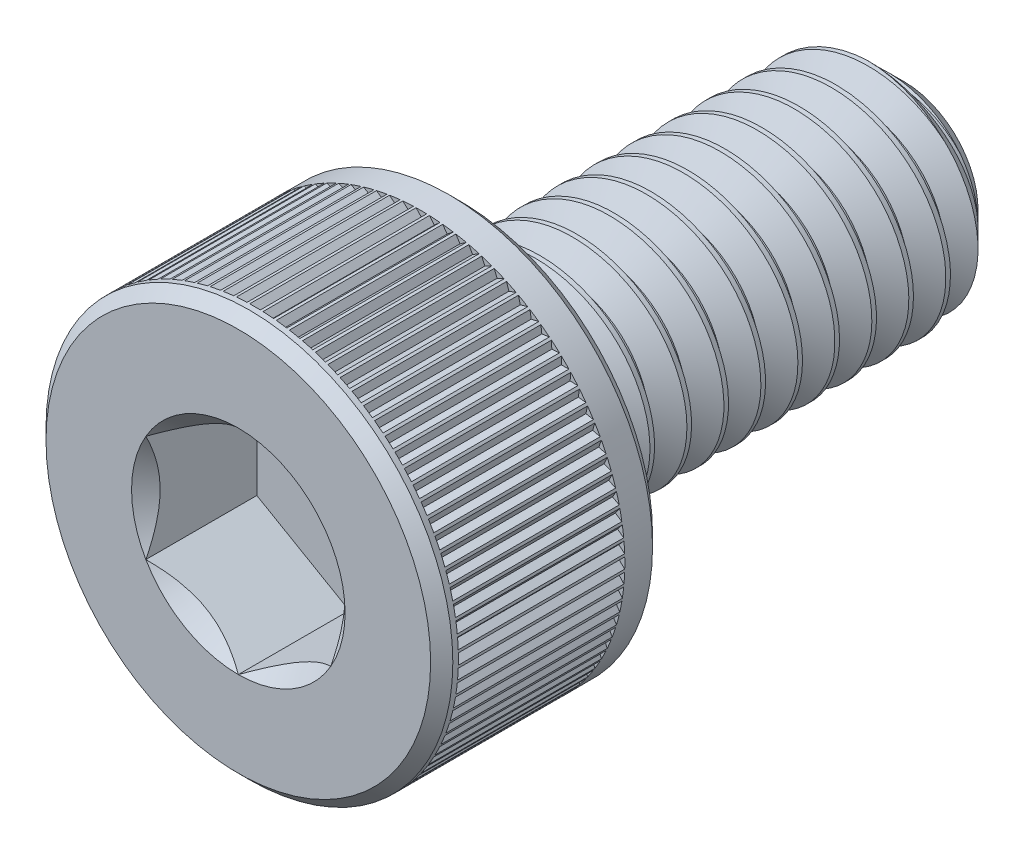
from build123d import *

# Parameters (mm, degrees)
CUT_EXTRUDE1_START = -1.5
CUT_EXTRUDE1_DEPTH = 1.5
SKETCH4_R          = 1.443375673
CUT_EXTRUDE2_DEPTH = 0.5
CUT_EXTRUDE2_DRAFT = -45
CUT_SWEEP1_PITCH   = 0.5
CUT_EXTRUDE4_START = -0.975
CUT_EXTRUDE4_DEPTH = 2.25
CIRPATTERN2_COUNT  = 96


# Read off the part's stored shape, not the designer's step: Split1
with BuildPart() as part:
    # Sketch2 → Revolve1 (revolve)
    with BuildSketch(Plane(origin=(0, 0, 0), x_dir=(0, 0, -1), z_dir=(1, 0, 0)), mode=Mode.PRIVATE) as revolve1_sk:
        Polygon((-4.35, 2.75), (-1.65, 2.75), (-1.5, 2.6), (-1.5, 1.5), (4, 1.5), (4.5, 1), (4.5, 0), (-4.5, 0), (-4.5, 2.6), align=None)
    revolve(revolve1_sk.sketch.rotate(Axis((0, 0, -4.5), (0, 0, 1)), 90), axis=Axis((0, 0, -4.5), (0, 0, 1)))

    # Sketch3 → Cut-Extrude1 (cut)
    with BuildSketch(Plane.XY.offset(4.5).offset(CUT_EXTRUDE1_START)):
        Polygon((0, 1.443375673), (-1.25, 0.721687836), (-1.25, -0.721687836), (0, -1.443375673), (1.25, -0.721687836), (1.25, 0.721687836), align=None)
    extrude(amount=CUT_EXTRUDE1_DEPTH, mode=Mode.SUBTRACT)


with BuildPart() as cut_extrude2_tool:
    # Sketch4 → Cut-Extrude2 (with draft: the straight prism first)
    with BuildSketch(Plane.XY.offset(4.5)):
        Circle(SKETCH4_R)
    extrude(amount=-CUT_EXTRUDE2_DEPTH)
    # Cut-Extrude2: the draft: its side faces are tilted about the plane it starts from
    cut_extrude2_sides = [cut_extrude2_tool.faces().sort_by_distance(p)[0] for p in [
        (-1.443375673, 0, 4.25),
    ]]
    draft(cut_extrude2_sides, Plane.XY.offset(4.5), CUT_EXTRUDE2_DRAFT)


with BuildPart() as part_1:
    add(part.part)

    # Cut-Extrude2: cut by cut_extrude2_tool
    add(cut_extrude2_tool.part, mode=Mode.SUBTRACT)


with BuildPart() as body_2:
    # Split1: the piece on the far side of the plane
    add(part_1.part)
    split(bisect_by=Plane.XY.offset(1.5), keep=Keep.BOTTOM)

    # Cut-Sweep1: the profile of Sketch7 screwed along a right-hand helix of 13 turns, 6 arcs to a turn; built about Z, then put on its axis
    cut_sweep1_z = Axis((0, 0, 0), (0, 0, 1))
    cut_sweep1_corners = [(1.527063294, 0, 0.015625), (1.527063294, 0, -0.453125), (1.175240474, 0, -0.25), (1.175240474, 0, -0.1875)]
    with BuildLine(mode=Mode.PRIVATE) as cut_sweep1_profile:
        Line(cut_sweep1_corners[0], cut_sweep1_corners[1])
        Line(cut_sweep1_corners[1], cut_sweep1_corners[2])
        Line(cut_sweep1_corners[2], cut_sweep1_corners[3])
        Line(cut_sweep1_corners[3], cut_sweep1_corners[0])
    cut_sweep1_cap = Face(cut_sweep1_profile.wire())
    cut_sweep1_turn_angles = [0, 30, 60, 90, 120, 150, 180, 210, 240, 270, 300, 330, 360]
    cut_sweep1_turn_weights = [1, 0.8660254037844387, 1, 0.8660254037844387, 1, 0.8660254037844387, 1, 0.8660254037844387, 1, 0.8660254037844387, 1, 0.8660254037844387, 1]
    cut_sweep1_turn_rails = [Edge.make_bspline([Vector(p[0], p[1], 0).rotate(cut_sweep1_z, cut_sweep1_turn_angles[k]) / cut_sweep1_turn_weights[k] + Vector(0, 0, p[2] + CUT_SWEEP1_PITCH * cut_sweep1_turn_angles[k] / 360) for k in range(13)], [0, 0, 0, 1, 1, 2, 2, 3, 3, 4, 4, 5, 5, 6, 6, 6], 2, cut_sweep1_turn_weights) for p in cut_sweep1_corners]
    cut_sweep1_turn_sides = [Face.make_surface_from_curves(cut_sweep1_turn_rails[p[0]], cut_sweep1_turn_rails[p[1]]) for p in [(0, 1), (1, 2), (2, 3), (3, 0)]]
    cut_sweep1 = Plane(origin=(0, 0, -4.5), x_dir=(0, 1, 0), z_dir=(0, 0, 1)) * Solid(Shell([*[p.moved(Location((0, 0, CUT_SWEEP1_PITCH * i))) for i in range(13) for p in cut_sweep1_turn_sides], cut_sweep1_cap, cut_sweep1_cap.rotate(cut_sweep1_z, 4680).moved(Location((0, 0, CUT_SWEEP1_PITCH * 4680 / 360)))]))
    add(cut_sweep1, mode=Mode.SUBTRACT)


with BuildPart() as part_2:
    add(part_1.part)

    # Split1
    split(bisect_by=Plane.XY.offset(1.5), keep=Keep.TOP)

    add(body_2.part)  # Boss-Extrude1 merges body 2
    # Boss-Extrude1 cone 1 section (through the dimple's axis) → Boss-Extrude1 (revolve)
    with BuildSketch(Plane(origin=(0, 0, 1.5), x_dir=(0, -1, 0), z_dir=(1, 0, 0))):
        Polygon((0, 0), (1.5, 0), (0, 1.5), align=None)
    revolve(axis=Axis((0, 0, 1.5), (0, 0, -1)))

    # Sketch9 → Cut-Extrude4 (cut)
    with BuildSketch(Plane.XY.offset(3).offset(CUT_EXTRUDE4_START)):
        with BuildLine():
            Line((0, 2.674375), (0.071986608, 2.749057644))
            ThreePointArc((0.071986608, 2.749057644), (0, 2.75), (-0.071986608, 2.749057644))
            Line((-0.071986608, 2.749057644), (0, 2.674375))
        make_face()
    cut_extrude4 = extrude(amount=CUT_EXTRUDE4_DEPTH, mode=Mode.SUBTRACT)

    # CirPattern2: Cut-Extrude4 ×96 about axis
    cirpattern2_axis = Axis((0, 0, 0), (0, 0, 1))
    for i in range(1, CIRPATTERN2_COUNT):
        add(cut_extrude4.rotate(cirpattern2_axis, i * 360 / CIRPATTERN2_COUNT), mode=Mode.SUBTRACT)


solid = part_2.part
